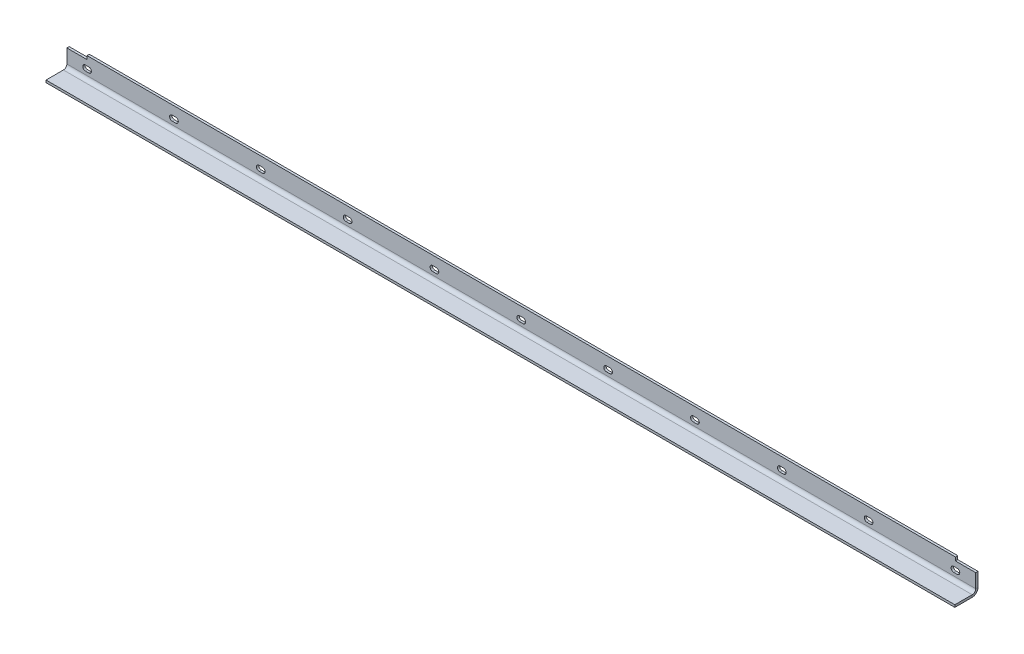
from build123d import *

# Parameters (mm, degrees)
SKETCH1_W                    = 1570
SKETCH1_H                    = 40
BASE_FLANGE1_DEPTH           = 4
EDGE_FLANGE1_STRIP_W         = 28
EDGE_FLANGE1_STRIP_H         = 4
EDGE_FLANGE1_STRIP_CUT_DEPTH = 1570
EDGE_FLANGE1_DEPTH           = 1570
SKETCH9_W                    = 35
SKETCH9_H                    = 6
CUT_EXTRUDE1_DEPTH           = 10
CUT_EXTRUDE2_DEPTH           = 10
LPATTERN1_COUNT              = 11
LPATTERN1_PITCH              = 150


# Sheet-metal steps are written as plain solids
with BuildPart() as part:
    # Sketch1 → Base-Flange1 (new body)
    with BuildSketch(Plane(origin=(0, 0, 0), x_dir=(1, 0, 0), z_dir=(0, 1, 0))):
        with Locations((-479.623655914, 20)):
            Rectangle(SKETCH1_W, SKETCH1_H)
    extrude(amount=-BASE_FLANGE1_DEPTH)

    # Edge-Flange1 strip (across the edge) → Edge-Flange1 strip cut (cut)
    with BuildSketch(Plane(origin=(305.376344086, 0, -40), x_dir=(0, 0, 1), z_dir=(-1, 0, 0))):
        with Locations((-4, -2)):
            Rectangle(EDGE_FLANGE1_STRIP_W, EDGE_FLANGE1_STRIP_H)
    extrude(amount=EDGE_FLANGE1_STRIP_CUT_DEPTH, mode=Mode.SUBTRACT)

    # Edge-Flange1 section (across the edge) → Edge-Flange1 (add)
    with BuildSketch(Plane(origin=(305.376344086, 0, -40), x_dir=(0, 0, 1), z_dir=(-1, 0, 0))):
        with BuildLine():
            Line((0, 6), (0, 36))
            Line((0, 36), (4, 36))
            Line((4, 36), (4, 6))
            ThreePointArc((4, 6), (5.757359313, 1.757359313), (10, 0))
            Line((10, 0), (10, -4))
            ThreePointArc((10, -4), (2.928932188, -1.071067812), (0, 6))
        make_face()
    extrude(amount=EDGE_FLANGE1_DEPTH)

    # Sketch9 → Cut-Extrude1 (cut)
    with BuildSketch(Plane.XY.offset(-36)):
        with Locations((287.876344086, 33)):
            Rectangle(SKETCH9_W, SKETCH9_H)
        with Locations((-1247.123655914, 33)):
            Rectangle(SKETCH9_W, SKETCH9_H)
    extrude(amount=-CUT_EXTRUDE1_DEPTH, mode=Mode.SUBTRACT)

    # Sketch10 → Cut-Extrude2 (cut)
    with BuildSketch(Plane.XY.offset(-36)):
        with BuildLine():
            Line((273.376344086, 11.5), (267.376344086, 11.5))
            ThreePointArc((267.376344086, 11.5), (262.876344086, 16), (267.376344086, 20.5))
            Line((267.376344086, 20.5), (273.376344086, 20.5))
            ThreePointArc((273.376344086, 20.5), (277.876344086, 16), (273.376344086, 11.5))
        make_face()
    cut_extrude2 = extrude(amount=-CUT_EXTRUDE2_DEPTH, mode=Mode.SUBTRACT)

    # LPattern1: Cut-Extrude2 ×11
    with Locations(*[(-i * LPATTERN1_PITCH, 0, 0) for i in range(1, LPATTERN1_COUNT)]):
        add(cut_extrude2, mode=Mode.SUBTRACT)


solid = part.part
